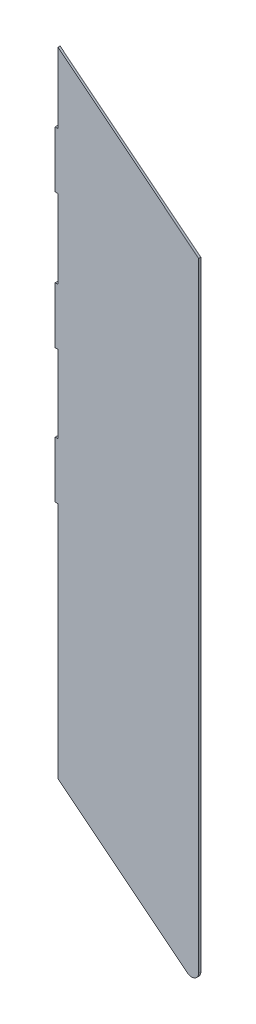
from build123d import *

# Parameters (mm, degrees)
BOSS_EXTRUDE1_DEPTH = 1.5
SKETCH7_W           = 1.5
SKETCH7_H           = 40
BOSS_EXTRUDE3_DEPTH = 2
FILLET1_R           = 5


with BuildPart() as part:
    # Sketch1 → Boss-Extrude1 (new body)
    with BuildSketch(Plane.XY):
        Polygon((0, -152.136839442), (0, 297.863160558), (100, 217.863160558), (100, -232.136839442), align=None)
    extrude(amount=BOSS_EXTRUDE1_DEPTH)

    # Sketch7 → Boss-Extrude3 (add)
    with BuildSketch(Plane.ZY):
        with Locations((0.75, 227.863160558)):
            Rectangle(SKETCH7_W, SKETCH7_H)
        with Locations((0.75, 131.983352075)):
            Rectangle(SKETCH7_W, SKETCH7_H)
        with Locations((0.75, 36.983352075)):
            Rectangle(SKETCH7_W, SKETCH7_H)
    extrude(amount=BOSS_EXTRUDE3_DEPTH)

    # Fillet1
    fillet1_edges = [part.edges().sort_by_distance(p)[0] for p in [
        (100, -232.136839442, 0.75),
    ]]
    fillet(fillet1_edges, radius=FILLET1_R)


solid = part.part
